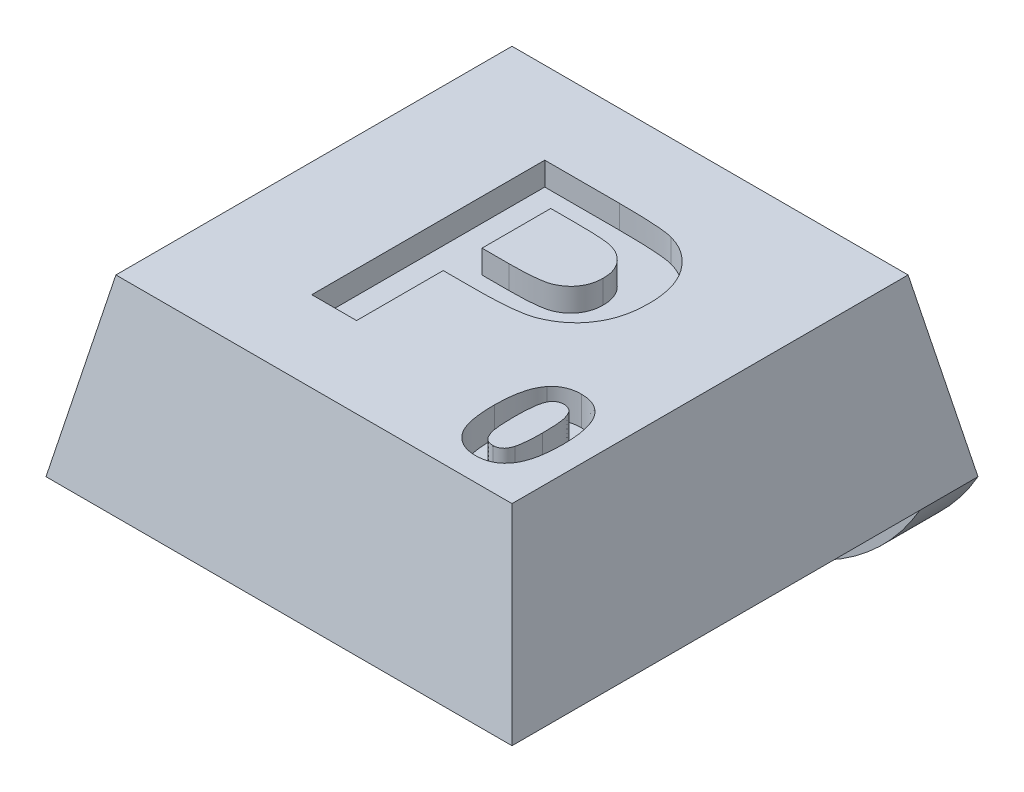
from build123d import *

# Parameters (mm, degrees)
SKETCH1_W               = 8
SKETCH1_H               = 8
BOSS_EXTRUDE1_DEPTH     = 3
CUT_EXTRUDE1_DEPTH      = 12.704699911
CUT_EXTRUDE1_DEPTH_BACK = 12.704699911
CUT_EXTRUDE2_DEPTH      = 11
SKETCH4_R               = 1.75
CUT_EXTRUDE3_DEPTH      = 0.4
SKETCH5_W               = 8
SKETCH5_H               = 1
BOSS_EXTRUDE2_DEPTH     = 2
FILLET1_R               = 4
CUT_EXTRUDE4_DEPTH      = 0.4
CUT_EXTRUDE5_DEPTH      = 0.5


with BuildPart() as part:
    # Sketch1 → Boss-Extrude1 (new body)
    with BuildSketch(Plane(origin=(0, 0, 0), x_dir=(1, 0, 0), z_dir=(0, 1, 0))):
        with Locations((4, 4)):
            Rectangle(SKETCH1_W, SKETCH1_H)
    extrude(amount=BOSS_EXTRUDE1_DEPTH)

    # Sketch2 → Cut-Extrude1 (cut, two sides: drawn at the far end of the back side and taken through both)
    with BuildSketch(Plane.XY.offset(-CUT_EXTRUDE1_DEPTH_BACK)):
        Polygon((0, 0), (0.6, 3), (0, 3), align=None)
        Polygon((8, 0), (7.4, 3), (8, 3), align=None)
    extrude(amount=CUT_EXTRUDE1_DEPTH + CUT_EXTRUDE1_DEPTH_BACK, mode=Mode.SUBTRACT)

    # Sketch3 → Cut-Extrude2 (cut)
    with BuildSketch(Plane(origin=(0, 0, 0), x_dir=(0, 0, -1), z_dir=(1, 0, 0))):
        Polygon((0, 0), (0.6, 3), (0, 3), align=None)
        Polygon((8, 3), (7.4, 3), (8, 0), align=None)
    extrude(amount=CUT_EXTRUDE2_DEPTH, mode=Mode.SUBTRACT)

    # Sketch4 → Cut-Extrude3 (cut)
    with BuildSketch(Plane.XZ):
        with Locations(Location((4, -3.75, 0), (0, 0, 270))):
            Circle(SKETCH4_R)
    extrude(amount=-CUT_EXTRUDE3_DEPTH, mode=Mode.SUBTRACT)

    # Sketch5 → Boss-Extrude2 (add)
    with BuildSketch(Plane.XZ):
        with Locations((4, -7.5)):
            Rectangle(SKETCH5_W, SKETCH5_H)
    extrude(amount=BOSS_EXTRUDE2_DEPTH)

    # Fillet1
    # the kernel refuses this fillet: 4 mm, written as the material it takes off along each edge
    with BuildSketch(Plane(origin=(8, -2, -16.660254038), x_dir=(0, 1, 0), z_dir=(0, 0, 1)), Plane(origin=(0, -2, 1.660254038), x_dir=(0, 1, 0), z_dir=(0, 0, -1))) as fillet1_piece_1:
        with BuildLine():
            CenterArc((4, 3.464101615), FILLET1_R, 180, 60)
            Line((0, 3.464101615), (-0.08, 3.464101615))
            Line((-0.08, 3.464101615), (-0.08, 0))
            Line((-0.08, 0), (0, -0.08))
            ThreePointArc((0, -0.08), (1, -0.08), (1.96, -0.069282032))
            Line((1.96, -0.069282032), (2, 0))
        make_face()
    extrude(amount=18.320508076, mode=Mode.SUBTRACT)

    # Sketch6 → Cut-Extrude4 (cut)
    with BuildSketch(Plane(origin=(0, 3, 0), x_dir=(1, 0, 0), z_dir=(0, 1, 0))):
        with BuildLine():
            Line((2.575068598, 1.987434605), (2.575068598, 5.987434605))
            Line((2.575068598, 5.987434605), (3.854716034, 5.987434605))
            add(Edge.make_bspline(
                [(3.854716034, 5.987434605), (3.91267733, 5.987371309), (4.0235352, 5.987250247), (4.181667245, 5.983886636), (4.324041461, 5.979125075), (4.450446542, 5.973194752), (4.561327274, 5.964345571), (4.656186257, 5.954098352), (4.735620814, 5.943075064), (4.782397472, 5.931667436), (4.803433983, 5.926537169)],
                knots=[0, 0, 0, 0, 1.460485487, 2.793352117, 3.985295279, 5.050041172, 5.981765236, 6.787433016, 7.454681457, 8, 8, 8, 8], degree=3))
            add(Edge.make_bspline(
                [(4.803433983, 5.926537169), (4.831407427, 5.918560862), (4.886928159, 5.902729762), (4.966472056, 5.868980371), (5.043139776, 5.829866627), (5.115968073, 5.783250114), (5.185204512, 5.72995844), (5.251054895, 5.670426205), (5.313870394, 5.604384669), (5.372782037, 5.531964292), (5.426738172, 5.453530256), (5.473369829, 5.368966598), (5.512437408, 5.278640875), (5.545722335, 5.183231873), (5.570280113, 5.081716653), (5.587466094, 4.974800554), (5.59942968, 4.862436815), (5.600276739, 4.785544235), (5.600709624, 4.746248708)],
                knots=[0, 0, 0, 0, 0.907145743, 1.80047177, 2.69161667, 3.591261238, 4.495029544, 5.415863088, 6.359363025, 7.337192411, 8.326890979, 9.326929023, 10.346104993, 11.395420813, 12.477187422, 13.601053412, 14.774031606, 16, 16, 16, 16], degree=3))
            add(Edge.make_bspline(
                [(5.600709624, 4.746248708), (5.599475039, 4.686573982), (5.597098394, 4.571696857), (5.570507962, 4.407006575), (5.529951011, 4.256572619), (5.470674098, 4.121843981), (5.398403226, 4.002291963), (5.318795373, 3.894516382), (5.227894903, 3.801765706), (5.129684965, 3.722543108), (5.025895009, 3.65771062), (4.921917172, 3.602441845), (4.816348426, 3.559949444), (4.744371889, 3.541435164), (4.708882701, 3.5323064)],
                knots=[0, 0, 0, 0, 1.312386234, 2.526415563, 3.661883817, 4.733421185, 5.753802465, 6.732107337, 7.675884281, 8.604170108, 9.50284679, 10.365392406, 11.194030444, 12, 12, 12, 12], degree=3))
            add(Edge.make_bspline(
                [(4.708882701, 3.5323064), (4.683552258, 3.527487955), (4.630158709, 3.517331247), (4.545479732, 3.507206857), (4.452921022, 3.496000262), (4.352101878, 3.488690691), (4.243144264, 3.481845584), (4.126090489, 3.478613784), (4.001107836, 3.47472012), (3.91508314, 3.474650156), (3.870741675, 3.474614092)],
                knots=[0, 0, 0, 0, 0.735353946, 1.55003838, 2.431865514, 3.394945452, 4.432993119, 5.54609699, 6.735134699, 8, 8, 8, 8], degree=3))
            Line((3.870741675, 3.474614092), (3.344299367, 3.474614092))
            Line((3.344299367, 3.474614092), (3.344299367, 1.987434605))
            Line((3.344299367, 1.987434605), (2.575068598, 1.987434605))
        make_face()
        with BuildLine():
            Line((3.344299367, 5.320767939), (3.344299367, 4.141280759))
            Line((3.344299367, 4.141280759), (3.805837829, 4.141280759))
            add(Edge.make_bspline(
                [(3.805837829, 4.141280759), (3.845638333, 4.141332297), (3.921781705, 4.141430897), (4.031030553, 4.144970031), (4.129922714, 4.149290201), (4.218664819, 4.156440966), (4.296721198, 4.165865503), (4.364614575, 4.177138437), (4.422424078, 4.189235472), (4.484937186, 4.209282199), (4.551776196, 4.241715975), (4.623152404, 4.288331456), (4.685856319, 4.344065763), (4.738034287, 4.409523776), (4.779712931, 4.482251421), (4.809554871, 4.56150336), (4.828823783, 4.645966113), (4.830583823, 4.704475652), (4.831478855, 4.734229477)],
                knots=[0, 0, 0, 0, 1.411705958, 2.700771114, 3.876961699, 4.922619712, 5.858038221, 6.66485904, 7.363650596, 7.950905807, 8.989198271, 9.987739806, 10.967313358, 11.951275539, 12.944273208, 13.927870418, 14.946261014, 16, 16, 16, 16], degree=3))
            add(Edge.make_bspline(
                [(4.831478855, 4.734229477), (4.830219195, 4.770469172), (4.827776882, 4.840733161), (4.800844983, 4.940800809), (4.759292142, 5.031613413), (4.699883375, 5.110345382), (4.628118983, 5.176552494), (4.547458802, 5.231639165), (4.456180297, 5.270189236), (4.391579581, 5.285125966), (4.358722444, 5.292723067)],
                knots=[0, 0, 0, 0, 1.085904563, 2.105425768, 3.088705091, 4.068969419, 5.045188284, 6.010769642, 6.988240112, 8, 8, 8, 8], degree=3))
            add(Edge.make_bspline(
                [(4.358722444, 5.292723067), (4.344583268, 5.294984513), (4.31319868, 5.300004222), (4.261031108, 5.305242912), (4.199316862, 5.310007496), (4.127981551, 5.313919362), (4.047307931, 5.316977535), (3.957029905, 5.319657249), (3.857385235, 5.319872528), (3.787674783, 5.320461199), (3.751350649, 5.320767939)],
                knots=[0, 0, 0, 0, 0.564603001, 1.253243608, 2.066786758, 3.005752288, 4.070476343, 5.250658742, 6.567396469, 8, 8, 8, 8], degree=3))
            Line((3.751350649, 5.320767939), (3.344299367, 5.320767939))
        make_face(mode=Mode.SUBTRACT)
    extrude(amount=-CUT_EXTRUDE4_DEPTH, mode=Mode.SUBTRACT)

    # Sketch7 → Cut-Extrude5 (cut)
    with BuildSketch(Plane(origin=(0, 3, 0), x_dir=(1, 0, 0), z_dir=(0, 1, 0))):
        with BuildLine():
            add(Edge.make_bspline(
                [(6.369450453, 2.82357546), (6.39087645, 2.823058679), (6.43259041, 2.822052565), (6.493372244, 2.81314022), (6.550601365, 2.79884977), (6.604273574, 2.778649207), (6.65433859, 2.752417608), (6.700462928, 2.720042876), (6.743654468, 2.682495475), (6.768596003, 2.65335807), (6.781229299, 2.638599499)],
                knots=[0, 0, 0, 0, 1.098584764, 2.138818609, 3.143716932, 4.11936356, 5.073598562, 6.034819447, 7.004603936, 8, 8, 8, 8], degree=3))
            add(Edge.make_bspline(
                [(6.781229299, 2.638599499), (6.788455746, 2.629200238), (6.803203657, 2.610017994), (6.823065779, 2.579021607), (6.842160507, 2.546141278), (6.858828341, 2.510585565), (6.874788514, 2.472971477), (6.889579056, 2.433213309), (6.902421223, 2.390982565), (6.914504951, 2.346819238), (6.924352081, 2.300033604), (6.93345174, 2.251130742), (6.940995767, 2.199888952), (6.946944677, 2.146472181), (6.952257643, 2.090961699), (6.955168891, 2.033092617), (6.957552583, 1.972994149), (6.95779081, 1.932111826), (6.957911991, 1.911315845)],
                knots=[0, 0, 0, 0, 0.746761706, 1.524009783, 2.317797294, 3.140957436, 3.996208027, 4.892396322, 5.812273159, 6.776774596, 7.776522781, 8.823794876, 9.910947555, 11.039215469, 12.21036455, 13.424061321, 14.689674014, 16, 16, 16, 16], degree=3))
            add(Edge.make_bspline(
                [(6.957911991, 1.911315845), (6.957792635, 1.890519816), (6.957558686, 1.84975752), (6.955160005, 1.789779622), (6.952255048, 1.732031195), (6.946957072, 1.676517748), (6.940951203, 1.623111596), (6.933622865, 1.571927247), (6.923838443, 1.523249094), (6.91414622, 1.47653808), (6.902133335, 1.432186718), (6.888714064, 1.390031707), (6.874517992, 1.349777916), (6.858186744, 1.312115406), (6.840920863, 1.276515693), (6.8221103, 1.24329975), (6.802026401, 1.212111266), (6.787135813, 1.192827825), (6.779786991, 1.183311037)],
                knots=[0, 0, 0, 0, 1.308387162, 2.564569672, 3.776470597, 4.945886788, 6.07248526, 7.158029334, 8.197718558, 9.195987466, 10.159061779, 11.087054987, 11.979325145, 12.84323098, 13.668471539, 14.467659354, 15.243757377, 16, 16, 16, 16], degree=3))
            add(Edge.make_bspline(
                [(6.779786991, 1.183311037), (6.767269282, 1.168678967), (6.742558721, 1.139794556), (6.69984521, 1.10255854), (6.653797336, 1.07085336), (6.603820502, 1.045143051), (6.550410554, 1.024803101), (6.493087779, 1.01096866), (6.432471995, 1.002038171), (6.390757271, 1.001019069), (6.369450453, 1.000498537)],
                knots=[0, 0, 0, 0, 0.991631672, 1.957528776, 2.911425699, 3.867574088, 4.848108326, 5.850523106, 6.902101959, 8, 8, 8, 8], degree=3))
            add(Edge.make_bspline(
                [(6.369450453, 1.000498537), (6.347900105, 1.001118641), (6.305671082, 1.002333766), (6.244014877, 1.011966411), (6.185407825, 1.027397849), (6.130060324, 1.049429828), (6.078051565, 1.077981657), (6.028975236, 1.112207425), (5.983899039, 1.153656886), (5.948609295, 1.192244047), (5.922791212, 1.227110384), (5.904581879, 1.256022799), (5.8869845, 1.286960237), (5.871795846, 1.320889957), (5.85681089, 1.35680842), (5.843538928, 1.395489719), (5.831829619, 1.436601232), (5.820835323, 1.479955232), (5.811667699, 1.525850343), (5.803234832, 1.574151127), (5.796589277, 1.625062995), (5.790697309, 1.678302375), (5.786549025, 1.733994943), (5.78318009, 1.792049563), (5.781490801, 1.852652064), (5.78115845, 1.893887179), (5.780988914, 1.914921614)],
                knots=[0, 0, 0, 0, 1.257818097, 2.464759732, 3.634271214, 4.790227596, 5.933394726, 7.09190477, 8.274482889, 9.50191983, 10.139172818, 10.805000628, 11.49619854, 12.215266328, 12.973768034, 13.768328009, 14.601232062, 15.469317089, 16.379095881, 17.333267023, 18.331755967, 19.376479622, 20.460535752, 21.592206075, 22.771760786, 24, 24, 24, 24], degree=3))
            add(Edge.make_bspline(
                [(5.780988914, 1.914921614), (5.781107317, 1.935597532), (5.781339371, 1.976119674), (5.783755545, 2.035856027), (5.786622112, 2.093367326), (5.791977754, 2.148754232), (5.797899386, 2.201932334), (5.805363507, 2.252971745), (5.814904658, 2.301608395), (5.825292905, 2.348036402), (5.836688103, 2.392420189), (5.850232122, 2.434388758), (5.864286307, 2.47457686), (5.880808434, 2.512038478), (5.897968312, 2.547563264), (5.916793594, 2.580772983), (5.936873788, 2.611963035), (5.951764856, 2.631246273), (5.959113914, 2.64076296)],
                knots=[0, 0, 0, 0, 1.304469132, 2.556591843, 3.77188756, 4.93702727, 6.066781583, 7.147865049, 8.190466662, 9.19316792, 10.149665317, 11.080258032, 11.975027628, 12.834388201, 13.661940433, 14.463366943, 15.241638981, 16, 16, 16, 16], degree=3))
            add(Edge.make_bspline(
                [(5.959113914, 2.64076296), (5.971630935, 2.655396438), (5.996340137, 2.684283628), (6.039063597, 2.721499302), (6.085162381, 2.753341336), (6.135285475, 2.778743904), (6.188572986, 2.799362705), (6.245820743, 2.81308675), (6.306426869, 2.822040809), (6.348142944, 2.823056613), (6.369450453, 2.82357546)],
                knots=[0, 0, 0, 0, 0.991667276, 1.957599061, 2.911530233, 3.873218945, 4.847995157, 5.850445929, 6.902062539, 8, 8, 8, 8], degree=3))
        make_face()
        with BuildLine():
            add(Edge.make_bspline(
                [(6.369450453, 2.52357546), (6.358474344, 2.523072492), (6.336762598, 2.522077575), (6.305205059, 2.514704272), (6.275401566, 2.502536716), (6.247208447, 2.485550965), (6.221248699, 2.461921448), (6.199258466, 2.430239338), (6.180267235, 2.391360135), (6.170763167, 2.362299534), (6.165724491, 2.346892768)],
                knots=[0, 0, 0, 0, 0.899391665, 1.779078861, 2.640979247, 3.529945348, 4.464599804, 5.495588918, 6.672261578, 8, 8, 8, 8], degree=3))
            add(Edge.make_bspline(
                [(6.165724491, 2.346892768), (6.162577751, 2.335267936), (6.155814574, 2.310283097), (6.148138649, 2.269547425), (6.141808472, 2.22331675), (6.136463277, 2.171601815), (6.132113414, 2.114375255), (6.12943462, 2.051600656), (6.127583085, 1.983322005), (6.127293442, 1.935956671), (6.127142761, 1.911315845)],
                knots=[0, 0, 0, 0, 0.658986521, 1.416336438, 2.266694271, 3.212608458, 4.261595115, 5.407496572, 6.651304179, 8, 8, 8, 8], degree=3))
            add(Edge.make_bspline(
                [(6.127142761, 1.911315845), (6.127348187, 1.886796916), (6.127741955, 1.839798243), (6.128860127, 1.772340716), (6.132034075, 1.710935357), (6.13521089, 1.655337457), (6.140502016, 1.605722201), (6.145823789, 1.56195561), (6.153158977, 1.524336592), (6.163167417, 1.483419148), (6.1783039, 1.440592552), (6.199070703, 1.397386801), (6.221339818, 1.362694606), (6.247568843, 1.337855227), (6.275956334, 1.321192362), (6.305399853, 1.308949279), (6.336928655, 1.302079246), (6.358481863, 1.301031661), (6.369450453, 1.300498537)],
                knots=[0, 0, 0, 0, 1.613353868, 3.092528792, 4.438413522, 5.658843895, 6.755779493, 7.721003256, 8.558527904, 9.275869043, 10.491421475, 11.538327284, 12.426656321, 13.187490948, 13.890032692, 14.581719216, 15.278226227, 16, 16, 16, 16], degree=3))
            add(Edge.make_bspline(
                [(6.369450453, 1.300498537), (6.380552792, 1.300975995), (6.402279645, 1.301910363), (6.43387853, 1.309529508), (6.463724458, 1.321331197), (6.49172893, 1.338663267), (6.517664365, 1.362130987), (6.539638544, 1.393841567), (6.558634851, 1.432711767), (6.568138148, 1.461773737), (6.573176414, 1.477181229)],
                knots=[0, 0, 0, 0, 0.909107913, 1.77908945, 2.650019014, 3.530482969, 4.465025013, 5.495890128, 6.672421267, 8, 8, 8, 8], degree=3))
            add(Edge.make_bspline(
                [(6.573176414, 1.477181229), (6.576318602, 1.488806983), (6.583041211, 1.513679902), (6.590771833, 1.554161984), (6.597119148, 1.600153094), (6.602413521, 1.651632777), (6.606806169, 1.708735723), (6.609462225, 1.771391927), (6.611315501, 1.839550023), (6.611606904, 1.886795193), (6.611758145, 1.911315845)],
                knots=[0, 0, 0, 0, 0.66114423, 1.414496391, 2.261103113, 3.210114492, 4.255954433, 5.405607896, 6.653488082, 8, 8, 8, 8], degree=3))
            add(Edge.make_bspline(
                [(6.611758145, 1.911315845), (6.611774868, 1.935837341), (6.611806925, 1.982844637), (6.609683032, 2.050387788), (6.607598618, 2.111974025), (6.603348141, 2.167482706), (6.599090914, 2.217101297), (6.592748703, 2.260581375), (6.586359424, 2.29840217), (6.575440132, 2.339234347), (6.560600724, 2.382184019), (6.540327287, 2.425838727), (6.517410268, 2.460205717), (6.491371352, 2.485467178), (6.463123586, 2.502496295), (6.433607808, 2.51477653), (6.402132873, 2.522065414), (6.380424737, 2.523068408), (6.369450453, 2.52357546)],
                knots=[0, 0, 0, 0, 1.611146624, 3.088541111, 4.440175916, 5.659517762, 6.746360572, 7.711365618, 8.546319149, 9.264661039, 10.486047304, 11.528122518, 12.419721574, 13.184982167, 13.89070983, 14.574167459, 15.279187713, 16, 16, 16, 16], degree=3))
        make_face(mode=Mode.SUBTRACT)
    extrude(amount=-CUT_EXTRUDE5_DEPTH, mode=Mode.SUBTRACT)


solid = part.part
